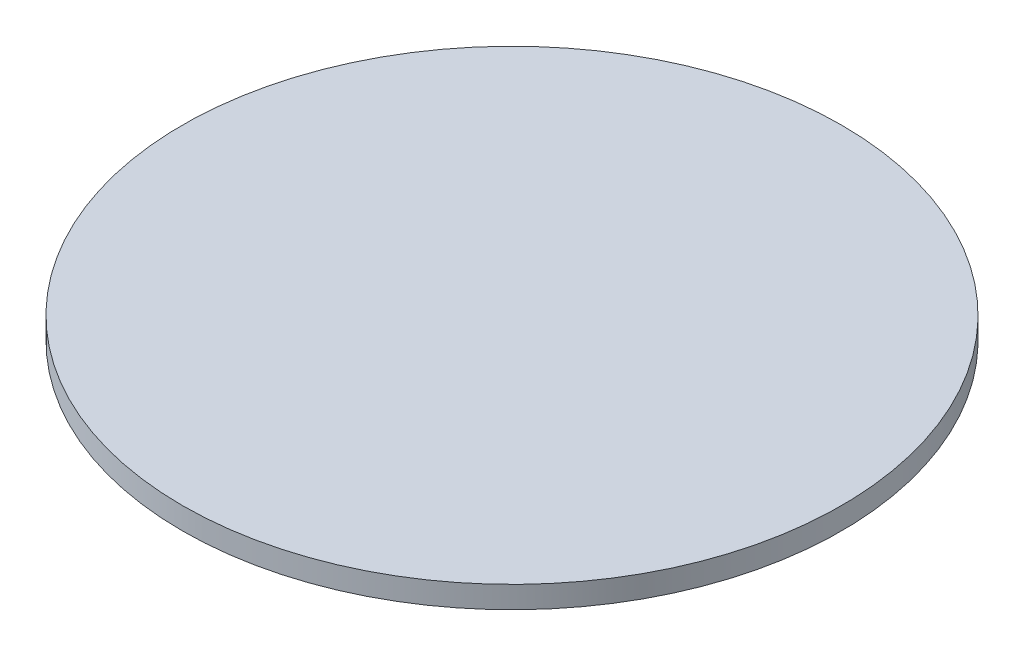
from build123d import *

# Parameters (mm, degrees)
SKETCH_1_R      = 15
EXTRUDE_1_DEPTH = 1


with BuildPart() as part:
    # 草图1 → 凸台-拉伸1 (new body)
    with BuildSketch(Plane(origin=(0, 0, 0), x_dir=(1, 0, 0), z_dir=(0, 1, 0))):
        Circle(SKETCH_1_R)
    extrude(amount=EXTRUDE_1_DEPTH)


solid = part.part
